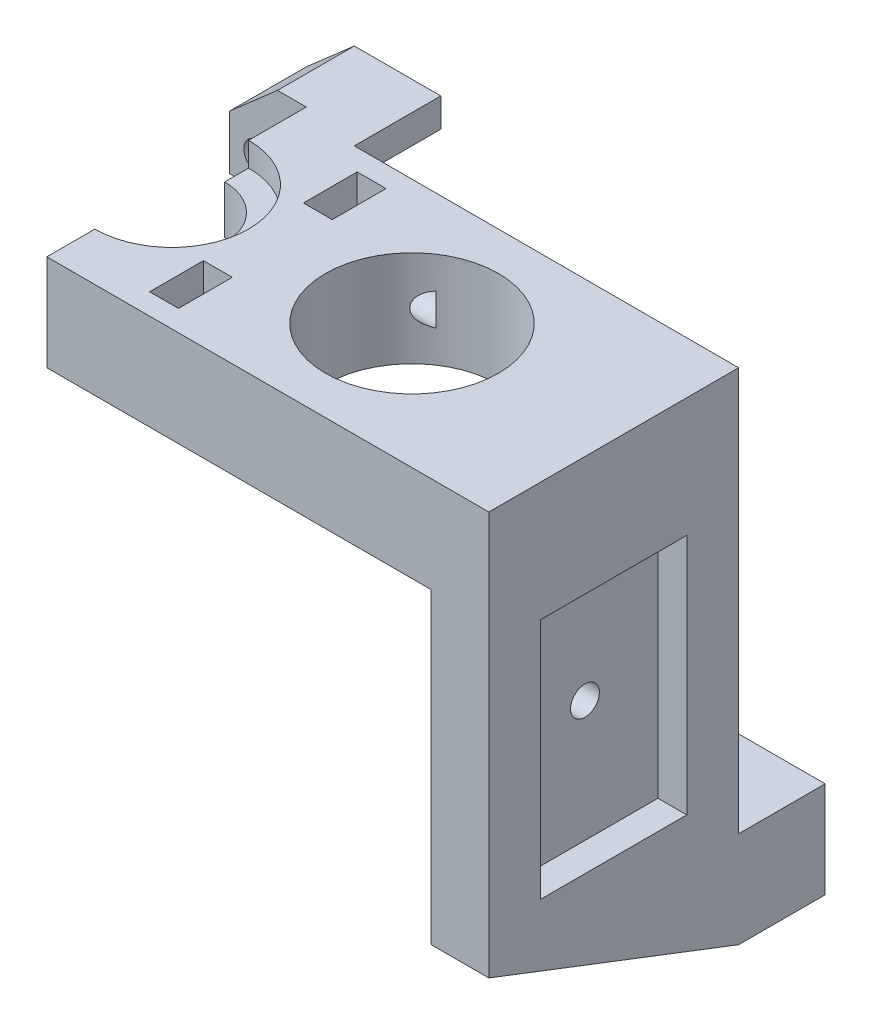
from build123d import *

# Parameters (mm, degrees)
RESSALTO_EXTRUS_O1_DEPTH   = 26
ESBO_O4_R                  = 1.75
CORTE_EXTRUS_O1_DEPTH      = 20
ESBO_O7_R                  = 9
CORTE_EXTRUS_O3_DEPTH      = 10
ESBO_O10_W                 = 15.2
ESBO_O10_H                 = 25.2
CORTE_EXTRUS_O6_DEPTH      = 3
CORTE_EXTRUS_O7_DEPTH      = 73.311824891
CORTE_EXTRUS_O7_DEPTH_BACK = 73.311824891
ESBO_O11_R                 = 1.5
ESBO_O12_R                 = 1.5
RESSALTO_EXTRUS_O3_DEPTH   = 9
ESBO_O5_W                  = 3
ESBO_O5_H                  = 5.6
ESBO_O5_W_2                = 8
ESBO_O5_H_2                = 1
CORTE_EXTRUS_O2_DEPTH      = 25


with BuildPart() as part:
    # Esboço1 → Ressalto-extrusão1 (new body)
    with BuildSketch(Plane.XY):
        Polygon((0, 0), (-6, 0), (-6, 42), (-46, 42), (-46, 52), (0, 52), align=None)
    extrude(amount=RESSALTO_EXTRUS_O1_DEPTH)

    # Esboço3 → Corte-Revolução1 (revolve, cut)
    with BuildSketch(Plane.ZY.offset(46)):
        Polygon((13, 52), (21, 52), (21, 49.5), (18.5, 49.5), (18.5, 44.5), (21, 44.5), (21, 42), (13, 42), align=None)
    revolve(axis=Axis((-46, 52, 13), (0, -1, 0)), mode=Mode.SUBTRACT)

    # Esboço4 → Corte-extrusão1 (cut)
    with BuildSketch(Plane.ZY.offset(46)):
        with Locations((5, 47)):
            Circle(ESBO_O4_R)
        with Locations((21, 47)):
            Circle(ESBO_O4_R)
    extrude(amount=-CORTE_EXTRUS_O1_DEPTH, mode=Mode.SUBTRACT)

    # Esboço7 → Corte-extrusão3 (cut)
    with BuildSketch(Plane(origin=(0, 52, 0), x_dir=(1, 0, 0), z_dir=(0, 1, 0))):
        with Locations((-21, -13)):
            Circle(ESBO_O7_R)
    extrude(amount=-CORTE_EXTRUS_O3_DEPTH, mode=Mode.SUBTRACT)

    # Esboço10 → Corte-extrusão6 (cut)
    with BuildSketch(Plane(origin=(0, 0, 0), x_dir=(0, 0, -1), z_dir=(1, 0, 0))):
        with Locations((-13, 27)):
            Rectangle(ESBO_O10_W, ESBO_O10_H)
    extrude(amount=-CORTE_EXTRUS_O6_DEPTH, mode=Mode.SUBTRACT)

    # Esboço11 → Corte-extrusão7 (cut, two sides: drawn at the far end of the back side and taken through both)
    with BuildSketch(Plane(origin=(-3, 0, 0), x_dir=(0, 0, -1), z_dir=(1, 0, 0)).offset(-CORTE_EXTRUS_O7_DEPTH_BACK)):
        with Locations((-13, 27)):
            Circle(ESBO_O11_R)
        Polygon((0, 0), (-26, 10), (-26, 0), align=None)
    extrude(amount=CORTE_EXTRUS_O7_DEPTH + CORTE_EXTRUS_O7_DEPTH_BACK, mode=Mode.SUBTRACT)

    # Esboço12 → Ressalto-extrusão3 (add)
    # profile 1 of 2: a face of its own
    with BuildSketch(Plane(origin=(0, 0, 0), x_dir=(-1, 0, 0), z_dir=(0, 0, -1))):
        Polygon((0, 0), (16, 0), (16, 5.530409069), (10.526896335, 10), (0, 10), align=None)
        with Locations((11, 5)):
            Circle(ESBO_O12_R, mode=Mode.SUBTRACT)
    # profile 2 of 2: a face of its own
    with BuildSketch(Plane(origin=(0, 0, 0), x_dir=(-1, 0, 0), z_dir=(0, 0, -1))):
        Polygon((40, 52), (49, 52), (54, 47.625), (54, 42), (48, 42), (40, 49), align=None)
        with Locations((51, 45)):
            Circle(ESBO_O12_R, mode=Mode.SUBTRACT)
    extrude(amount=RESSALTO_EXTRUS_O3_DEPTH)

    # Esboço5 → Corte-extrusão2 (cut)
    with BuildSketch(Plane(origin=(0, 52, 0), x_dir=(1, 0, 0), z_dir=(0, 1, 0))):
        with Locations((-36, -5)):
            Rectangle(ESBO_O5_W, ESBO_O5_H)
        with Locations((-36, -21)):
            Rectangle(ESBO_O5_W, ESBO_O5_H)
        with Locations((-50, 0.5)):
            Rectangle(ESBO_O5_W_2, ESBO_O5_H_2)
    extrude(amount=-CORTE_EXTRUS_O2_DEPTH, mode=Mode.SUBTRACT)


solid = part.part
